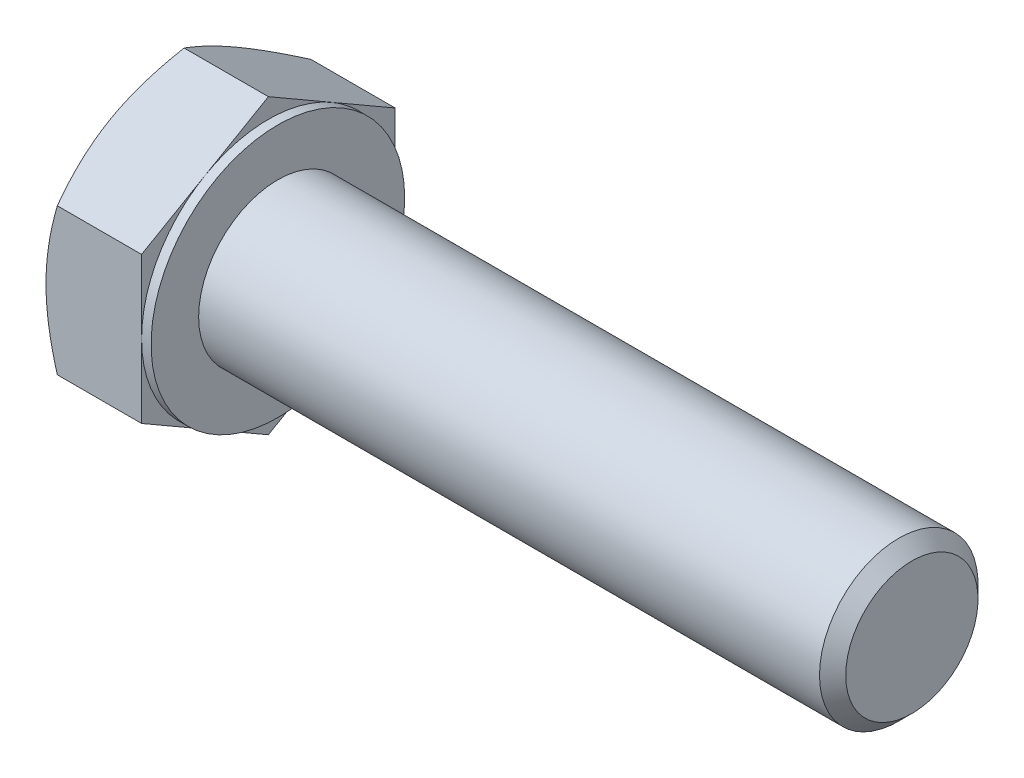
from build123d import *

# Parameters (mm, degrees)
BASEHEAD_DEPTH = 6.63
SKETCH4_W      = 0.6
SKETCH4_H      = 11.237604307


# Read off the part's stored shape, not the designer's step: HeadChamfer
with BuildPart() as part:
    # Sketch1 → BaseHead (new body)
    with BuildSketch(Plane(origin=(0, 0, 0), x_dir=(0, 0, -1), z_dir=(1, 0, 0))):
        Polygon((8, 4.618802154), (8, -4.618802154), (0, -9.237604307), (-8, -4.618802154), (-8, 4.618802154), (0, 9.237604307), align=None)
    extrude(amount=BASEHEAD_DEPTH)

    # HeadChamfer outline → HeadChamfer (revolve, cut)
    with BuildSketch(Plane.YX):
        Polygon((9.237604311, 0.714531182), (8, 0), (9.237604311, 0), align=None)
    revolve(axis=Axis((0, 0, 0), (1, 0, 0)), mode=Mode.SUBTRACT)

    # HeadChamfer 2 outline → HeadChamfer 2 (revolve)
    with BuildSketch(Plane.YX):
        Polygon((5, 6.63), (5, 45.802), (4.172, 46.63), (0, 46.63), (0, 6.63), align=None)
    revolve(axis=Axis((0, 0, 0), (1, 0, 0)))

    # Sketch4 → BearingFace (revolve, cut)
    with BuildSketch(Plane.XY, mode=Mode.PRIVATE) as bearingface_sk:
        with Locations((6.33, 13.618802154)):
            Rectangle(SKETCH4_W, SKETCH4_H)
    revolve(bearingface_sk.sketch.rotate(Axis((0, 0, 0), (1, 0, 0)), 90), axis=Axis((0, 0, 0), (1, 0, 0)), mode=Mode.SUBTRACT)


solid = part.part
